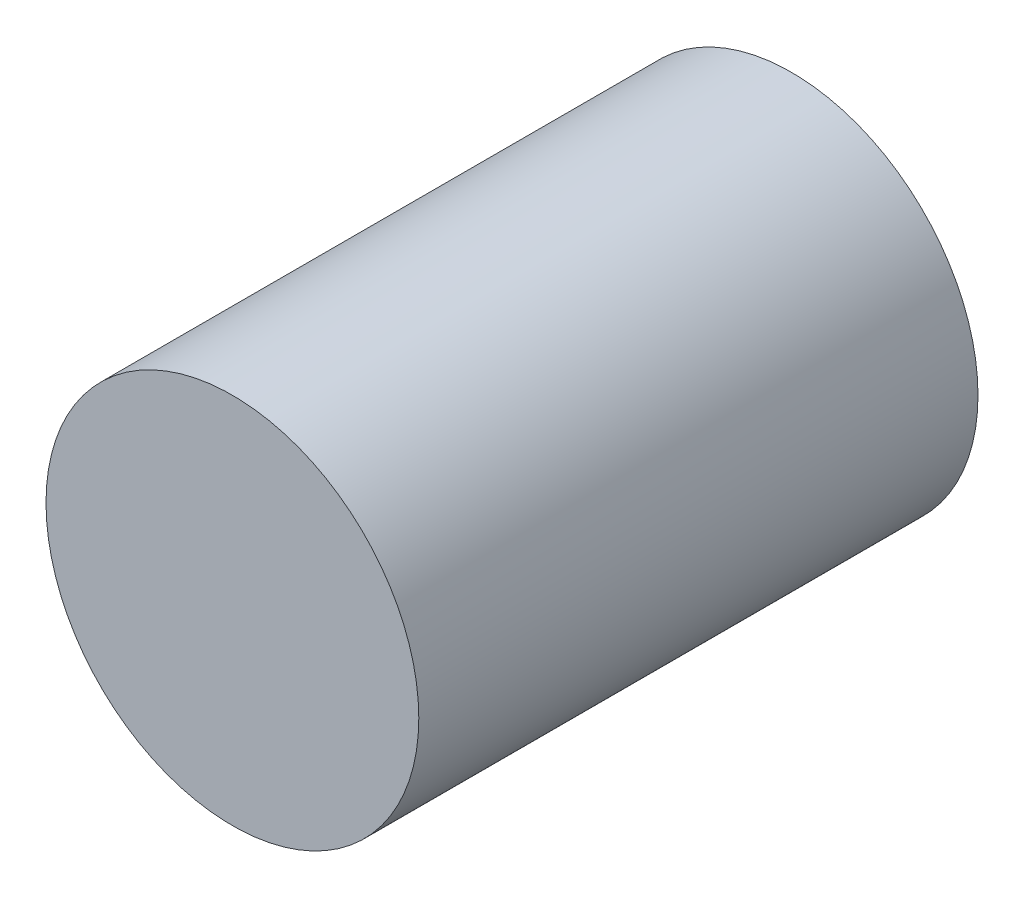
from build123d import *

# Parameters (mm, degrees)
SKETCH2_R           = 5.08
BOSS_EXTRUDE1_DEPTH = 15.24


with BuildPart() as part:
    # Sketch2 → Boss-Extrude1 (new body)
    with BuildSketch(Plane.XY):
        Circle(SKETCH2_R)
    extrude(amount=BOSS_EXTRUDE1_DEPTH)


solid = part.part
